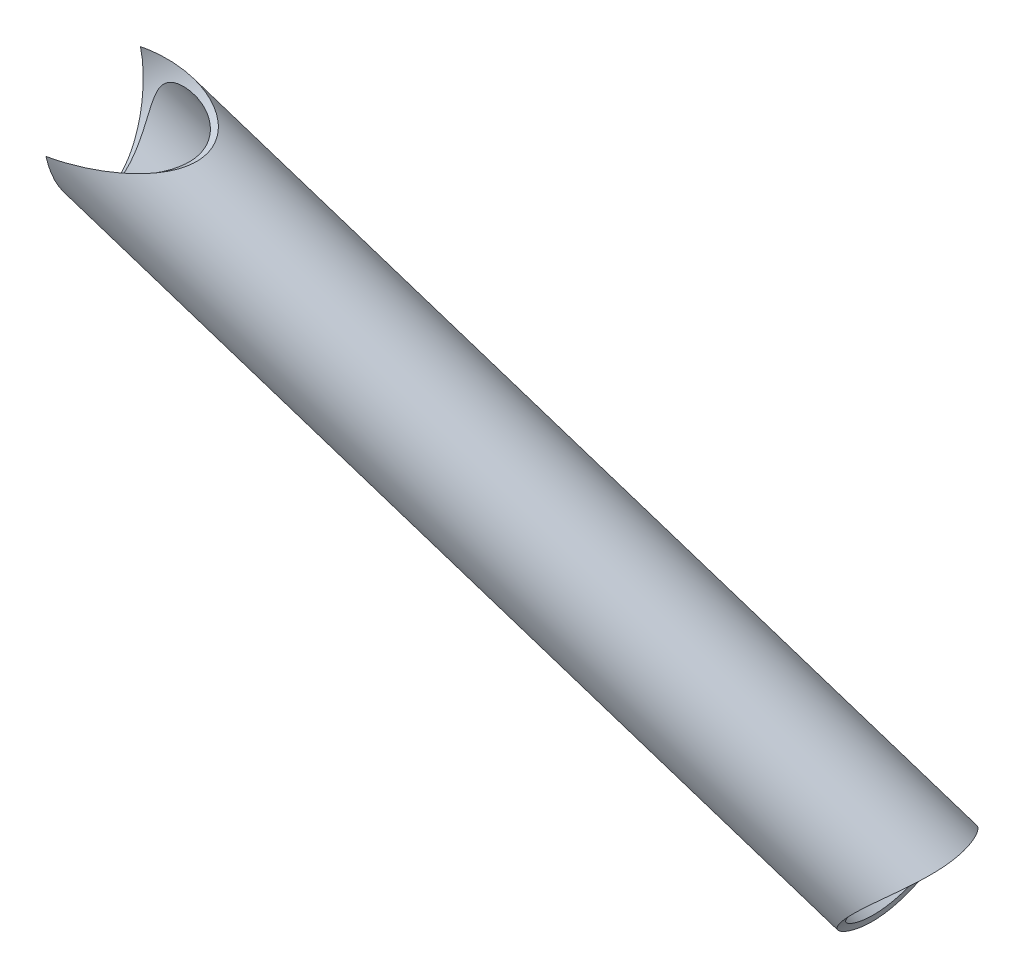
from build123d import *

# Parameters (mm, degrees)
BOSS_EXTRUDE1_OUTLINE_R   = 12.7
BOSS_EXTRUDE1_OUTLINE_R_2 = 11.049
BOSS_EXTRUDE1_DEPTH       = 169.483735571
BOSS_EXTRUDE1_START       = -1290
BOSS_EXTRUDE1_2_DEPTH     = 28
SKETCH2_R                 = 12.7


with BuildPart() as part:
    # Boss-Extrude1: read off the stored shape, not the designer's step
    # Boss-Extrude1 outline → Boss-Extrude1 (new body)
    with BuildSketch(Plane(origin=(-147.844678818, 698.675090596, 1422.4), x_dir=(-0.21607186737585407, 0.17125420007266837, -0.9612413573531791), z_dir=(0.7444978184598124, -0.6080485419276472, -0.2756809187597909))):
        Circle(BOSS_EXTRUDE1_OUTLINE_R)
        Circle(BOSS_EXTRUDE1_OUTLINE_R_2, mode=Mode.SUBTRACT)
    extrude(amount=BOSS_EXTRUDE1_DEPTH)

    # Boss-Extrude1 2 outline → Boss-Extrude1 2 (cut)
    with BuildSketch(Plane(origin=(0, 0, 0), x_dir=(0.9999874538242801, -0.000724766866537943, 0.0049565014901968504), z_dir=(0.00500921091921221, 0.144685018294151, -0.98946508442046)).offset(BOSS_EXTRUDE1_START)):
        with BuildLine():
            Line((-24.625498717, -777), (-23.968898636, -779.120116752))
            ThreePointArc((-23.968898636, -779.120116752), (-17.679414278, -790.467894395), (-7.375761107, -798.352334912))
            Line((-7.375761107, -798.352334912), (-5, -799.492339639))
            Line((-5, -799.492339639), (-5, -777))
            Line((-5, -777), (-24.625498717, -777))
        make_face()
    extrude(amount=BOSS_EXTRUDE1_2_DEPTH, mode=Mode.SUBTRACT)

    # Cut-Sweep1: sweep along a path in Sketch3
    with BuildLine(Plane.XY.offset(1422.4)) as cut_sweep1_path:
        ThreePointArc((-93.95089657, 718.69539577), (-147.844678818, 698.675090596), (-175.5974564, 648.324959307))
    # Sketch2 → Cut-Sweep1 (sweep, cut)
    with BuildSketch(Plane(origin=(-175.5974564, 648.324959307, 1422.4), x_dir=(0.9890558428813507, -0.14754165399052874, 1.0318371108759884e-15), z_dir=(0.14754165399052874, 0.9890558428813507, -6.916992563193179e-15))):
        Circle(SKETCH2_R)
    sweep(path=cut_sweep1_path.line, mode=Mode.SUBTRACT)


solid = part.part
